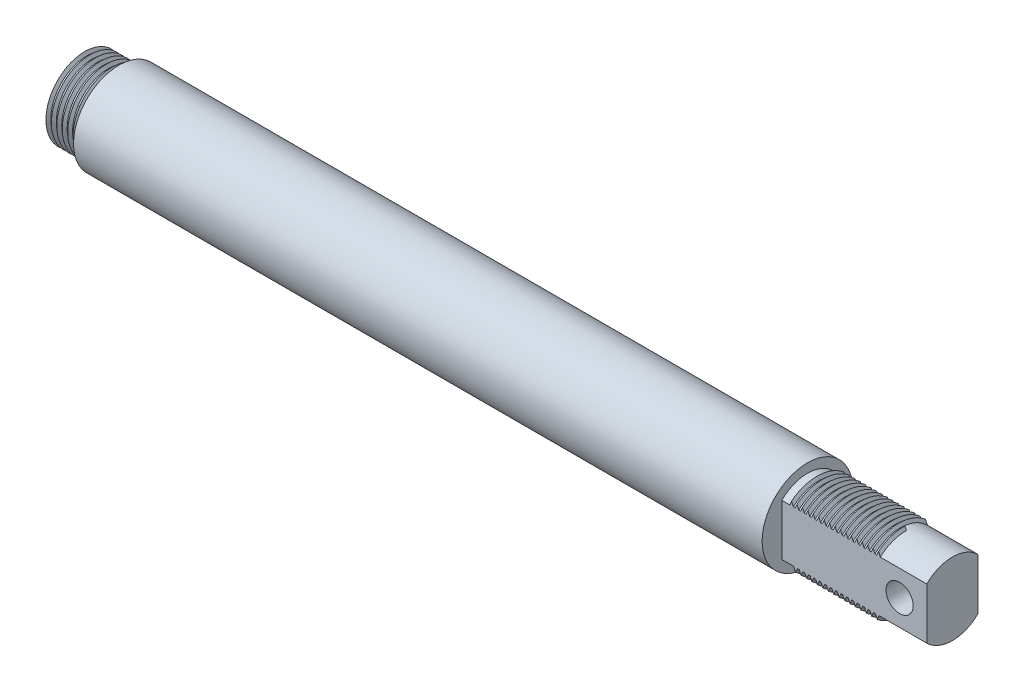
from build123d import *

# Parameters (mm, degrees)
SKETCH1_R               = 25
BOSS_EXTRUDE1_DEPTH     = 350
SKETCH2_R               = 20
CUT_EXTRUDE1_DEPTH      = 350
BOSS_EXTRUDE2_START     = 15
SKETCH3_R               = 25
BOSS_EXTRUDE2_DEPTH     = 15
SKETCH5_R               = 25
BOSS_EXTRUDE3_DEPTH     = 15
SKETCH6_R               = 20
BOSS_EXTRUDE4_DEPTH     = 80
CUT_EXTRUDE2_START      = -80
CUT_EXTRUDE2_DEPTH      = 80
SKETCH8_R               = 7.5
CUT_EXTRUDE3_DEPTH      = 70
SWEEP1_PITCH            = 3
CUT_EXTRUDE4_DEPTH      = 80
BOSS_EXTRUDE5_START     = 20
SKETCH14_R              = 20
BOSS_EXTRUDE5_DEPTH     = 20
SWEEP2_PITCH            = 3
CUT_EXTRUDE8_DEPTH      = 40
CUT_EXTRUDE8_DEPTH_BACK = 40
SKETCH17_W              = 2.766667784
SKETCH17_H              = 42.768183893
SKETCH18_R              = 5
CUT_EXTRUDE9_DEPTH      = 90


with BuildPart() as part:
    # Sketch1 → Boss-Extrude1 (new body)
    with BuildSketch(Plane(origin=(0, 0, 0), x_dir=(0, 0, -1), z_dir=(1, 0, 0))):
        Circle(SKETCH1_R)
    extrude(amount=BOSS_EXTRUDE1_DEPTH)

    # Sketch2 → Cut-Extrude1 (cut)
    with BuildSketch(Plane.ZY):
        Circle(SKETCH2_R)
    extrude(amount=-CUT_EXTRUDE1_DEPTH, mode=Mode.SUBTRACT)

    # Sketch3 → Boss-Extrude2 (add)
    with BuildSketch(Plane.ZY.offset(BOSS_EXTRUDE2_START)):
        Circle(SKETCH3_R)
    extrude(amount=-BOSS_EXTRUDE2_DEPTH)

    # Sketch5 → Boss-Extrude3 (add)
    with BuildSketch(Plane(origin=(350, 0, 0), x_dir=(0, 0, -1), z_dir=(1, 0, 0))):
        with Locations(Location((0, 0, 0), (0, 0, 180))):
            Circle(SKETCH5_R)
    extrude(amount=BOSS_EXTRUDE3_DEPTH)

    # Sketch6 → Boss-Extrude4 (add)
    with BuildSketch(Plane(origin=(365, 0, 0), x_dir=(0, 0, -1), z_dir=(1, 0, 0))):
        Circle(SKETCH6_R)
    extrude(amount=BOSS_EXTRUDE4_DEPTH)

    # Sketch7 → Cut-Extrude2 (cut)
    with BuildSketch(Plane(origin=(445, 0, 0), x_dir=(0, 0, -1), z_dir=(1, 0, 0)).offset(CUT_EXTRUDE2_START)):
        with BuildLine():
            ThreePointArc((-14.132830504, 14.151434625), (-20, 0), (-14.132830504, -14.151434625))
            Line((-14.132830504, -14.151434625), (-14.132830504, 14.151434625))
        make_face()
        with BuildLine():
            Line((14.132830504, 14.151434625), (14.132830504, -14.151434625))
            ThreePointArc((14.132830504, -14.151434625), (18.475072531, -7.659745098), (20, 0))
            ThreePointArc((20, 0), (18.475072531, 7.659745098), (14.132830504, 14.151434625))
        make_face()
    extrude(amount=CUT_EXTRUDE2_DEPTH, mode=Mode.SUBTRACT)

    # Sketch8 → Cut-Extrude3 (cut)
    with BuildSketch(Plane.XY.offset(14.132830504)):
        with Locations((430, 0)):
            Circle(SKETCH8_R)
    extrude(amount=-CUT_EXTRUDE3_DEPTH, mode=Mode.SUBTRACT)

    # Sweep1: arcs per turn and ends read off the stored shape
    # Sweep1: the profile of Sketch12 screwed along a left-hand helix through 16.25 turns, 10 arcs to a turn; built about Z, then put on its axis
    sweep1_z = Axis((0, 0, 0), (0, 0, 1))
    sweep1_corners = [(21.7, 0, 0), (19.15, 0, -1.472243186), (19.15, 0, 1.472243186)]
    with BuildLine(mode=Mode.PRIVATE) as sweep1_profile:
        Line(sweep1_corners[0], sweep1_corners[1])
        Line(sweep1_corners[1], sweep1_corners[2])
        Line(sweep1_corners[2], sweep1_corners[0])
    sweep1_cap = Face(sweep1_profile.wire())
    sweep1_turn_angles = [0, -18, -36, -54, -72, -90, -108, -126, -144, -162, -180, -198, -216, -234, -252, -270, -288, -306, -324, -342, -360]
    sweep1_turn_weights = [1, 0.9510565162951535, 1, 0.9510565162951535, 1, 0.9510565162951535, 1, 0.9510565162951535, 1, 0.9510565162951535, 1, 0.9510565162951535, 1, 0.9510565162951535, 1, 0.9510565162951535, 1, 0.9510565162951535, 1, 0.9510565162951535, 1]
    sweep1_turn_rails = [Edge.make_bspline([Vector(p[0], p[1], 0).rotate(sweep1_z, sweep1_turn_angles[k]) / sweep1_turn_weights[k] + Vector(0, 0, p[2] + -SWEEP1_PITCH * sweep1_turn_angles[k] / 360) for k in range(21)], [0, 0, 0, 1, 1, 2, 2, 3, 3, 4, 4, 5, 5, 6, 6, 7, 7, 8, 8, 9, 9, 10, 10, 10], 2, sweep1_turn_weights) for p in sweep1_corners]
    sweep1_turn_sides = [Face.make_surface_from_curves(sweep1_turn_rails[p[0]], sweep1_turn_rails[p[1]]) for p in [(0, 1), (1, 2), (2, 0)]]
    sweep1_last_angles = [-5760, -5778, -5796, -5814, -5832, -5841, -5850]
    sweep1_last_weights = [1, 0.9510565162951535, 1, 0.9510565162951535, 1, 0.9876883405951551, 1]
    sweep1_last_rails = [Edge.make_bspline([Vector(p[0], p[1], 0).rotate(sweep1_z, sweep1_last_angles[k]) / sweep1_last_weights[k] + Vector(0, 0, p[2] + -SWEEP1_PITCH * sweep1_last_angles[k] / 360) for k in range(7)], [0, 0, 0, 1, 1, 2, 2, 3, 3, 3], 2, sweep1_last_weights) for p in sweep1_corners]
    sweep1_last_sides = [Face.make_surface_from_curves(sweep1_last_rails[p[0]], sweep1_last_rails[p[1]]) for p in [(0, 1), (1, 2), (2, 0)]]
    sweep1 = Plane(origin=(370, 0, 0), x_dir=(0, 0, 1), z_dir=(1, 0, 0)) * Solid(Shell([*[p.moved(Location((0, 0, SWEEP1_PITCH * i))) for i in range(16) for p in sweep1_turn_sides], *sweep1_last_sides, sweep1_cap, sweep1_cap.rotate(sweep1_z, -5850).moved(Location((0, 0, -SWEEP1_PITCH * -5850 / 360)))]))
    add(sweep1)

    # Sketch13 → Cut-Extrude4 (cut)
    with BuildSketch(Plane(origin=(445, 0, 0), x_dir=(0, 0, -1), z_dir=(1, 0, 0))):
        with BuildLine():
            Line((-14.132830504, 14.151434625), (-14.132830504, 26.462484803))
            ThreePointArc((-14.132830504, 26.462484803), (-30, 0), (-14.132830504, -26.462484803))
            Line((-14.132830504, -26.462484803), (-14.132830504, -14.151434625))
            Line((-14.132830504, -14.151434625), (-14.132830504, 14.151434625))
        make_face()
        with BuildLine():
            ThreePointArc((30, 0), (25.729214087, 15.427493071), (14.132830504, 26.462484803))
            Line((14.132830504, 26.462484803), (14.132830504, 14.151434625))
            Line((14.132830504, 14.151434625), (14.132830504, -14.151434625))
            Line((14.132830504, -14.151434625), (14.132830504, -26.462484803))
            ThreePointArc((14.132830504, -26.462484803), (25.729214087, -15.427493071), (30, 0))
        make_face()
    extrude(amount=-CUT_EXTRUDE4_DEPTH, mode=Mode.SUBTRACT)

    # Sketch14 → Boss-Extrude5 (add)
    with BuildSketch(Plane.ZY.offset(15).offset(BOSS_EXTRUDE5_START)):
        Circle(SKETCH14_R)
    extrude(amount=-BOSS_EXTRUDE5_DEPTH)

    # Sweep2: arcs per turn and ends read off the stored shape
    # Sweep2: the profile of Sketch16 screwed along a right-hand helix through 5.75 turns, 10 arcs to a turn; built about Z, then put on its axis
    sweep2_z = Axis((0, 0, 0), (0, 0, 1))
    sweep2_corners = [(21.7, 0, 0), (19.15, 0, 1.472243186), (19.15, 0, -1.472243186)]
    with BuildLine(mode=Mode.PRIVATE) as sweep2_profile:
        Line(sweep2_corners[0], sweep2_corners[1])
        Line(sweep2_corners[1], sweep2_corners[2])
        Line(sweep2_corners[2], sweep2_corners[0])
    sweep2_cap = Face(sweep2_profile.wire())
    sweep2_turn_angles = [0, 18, 36, 54, 72, 90, 108, 126, 144, 162, 180, 198, 216, 234, 252, 270, 288, 306, 324, 342, 360]
    sweep2_turn_weights = [1, 0.9510565162951535, 1, 0.9510565162951535, 1, 0.9510565162951535, 1, 0.9510565162951535, 1, 0.9510565162951535, 1, 0.9510565162951535, 1, 0.9510565162951535, 1, 0.9510565162951535, 1, 0.9510565162951535, 1, 0.9510565162951535, 1]
    sweep2_turn_rails = [Edge.make_bspline([Vector(p[0], p[1], 0).rotate(sweep2_z, sweep2_turn_angles[k]) / sweep2_turn_weights[k] + Vector(0, 0, p[2] + SWEEP2_PITCH * sweep2_turn_angles[k] / 360) for k in range(21)], [0, 0, 0, 1, 1, 2, 2, 3, 3, 4, 4, 5, 5, 6, 6, 7, 7, 8, 8, 9, 9, 10, 10, 10], 2, sweep2_turn_weights) for p in sweep2_corners]
    sweep2_turn_sides = [Face.make_surface_from_curves(sweep2_turn_rails[p[0]], sweep2_turn_rails[p[1]]) for p in [(0, 1), (1, 2), (2, 0)]]
    sweep2_last_angles = [1800, 1818, 1836, 1854, 1872, 1890, 1908, 1926, 1944, 1962, 1980, 1998, 2016, 2034, 2052, 2061, 2070]
    sweep2_last_weights = [1, 0.9510565162951535, 1, 0.9510565162951535, 1, 0.9510565162951535, 1, 0.9510565162951535, 1, 0.9510565162951535, 1, 0.9510565162951535, 1, 0.9510565162951535, 1, 0.9876883405951284, 1]
    sweep2_last_rails = [Edge.make_bspline([Vector(p[0], p[1], 0).rotate(sweep2_z, sweep2_last_angles[k]) / sweep2_last_weights[k] + Vector(0, 0, p[2] + SWEEP2_PITCH * sweep2_last_angles[k] / 360) for k in range(17)], [0, 0, 0, 1, 1, 2, 2, 3, 3, 4, 4, 5, 5, 6, 6, 7, 7, 8, 8, 8], 2, sweep2_last_weights) for p in sweep2_corners]
    sweep2_last_sides = [Face.make_surface_from_curves(sweep2_last_rails[p[0]], sweep2_last_rails[p[1]]) for p in [(0, 1), (1, 2), (2, 0)]]
    sweep2 = Plane(origin=(-35, 0, 0), x_dir=(0, 0, -1), z_dir=(1, 0, 0)) * Solid(Shell([*[p.moved(Location((0, 0, SWEEP2_PITCH * i))) for i in range(5) for p in sweep2_turn_sides], *sweep2_last_sides, sweep2_cap, sweep2_cap.rotate(sweep2_z, 2070).moved(Location((0, 0, SWEEP2_PITCH * 2070 / 360)))]))
    add(sweep2)

    # Sketch17 → Cut-Extrude8 (cut, two sides: drawn at the far end of the back side and taken through both)
    with BuildSketch(Plane(origin=(0, 0, 0), x_dir=(1, 0, 0), z_dir=(0, 1, 0)).offset(-CUT_EXTRUDE8_DEPTH_BACK)):
        with Locations((-36.383333892, 1.384091946)):
            Rectangle(SKETCH17_W, SKETCH17_H)
    extrude(amount=CUT_EXTRUDE8_DEPTH + CUT_EXTRUDE8_DEPTH_BACK, mode=Mode.SUBTRACT)

    # Sketch18 → Cut-Extrude9 (cut)
    with BuildSketch(Plane.ZY.offset(35)):
        Circle(SKETCH18_R)
    extrude(amount=-CUT_EXTRUDE9_DEPTH, mode=Mode.SUBTRACT)


solid = part.part
